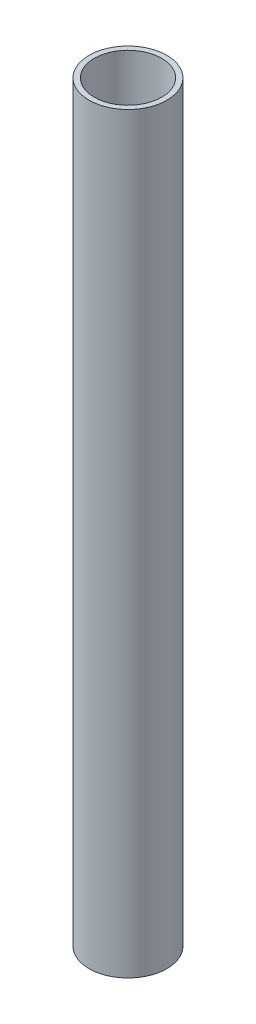
from build123d import *

# Parameters (mm, degrees)
SKETCH1_R           = 7.5
SKETCH1_R_2         = 6.5
BOSS_EXTRUDE1_DEPTH = 145


with BuildPart() as part:
    # Sketch1 → Boss-Extrude1 (new body)
    with BuildSketch(Plane(origin=(0, 0, 0), x_dir=(1, 0, 0), z_dir=(0, 1, 0))):
        Circle(SKETCH1_R)
        Circle(SKETCH1_R_2, mode=Mode.SUBTRACT)
    extrude(amount=BOSS_EXTRUDE1_DEPTH)


solid = part.part
